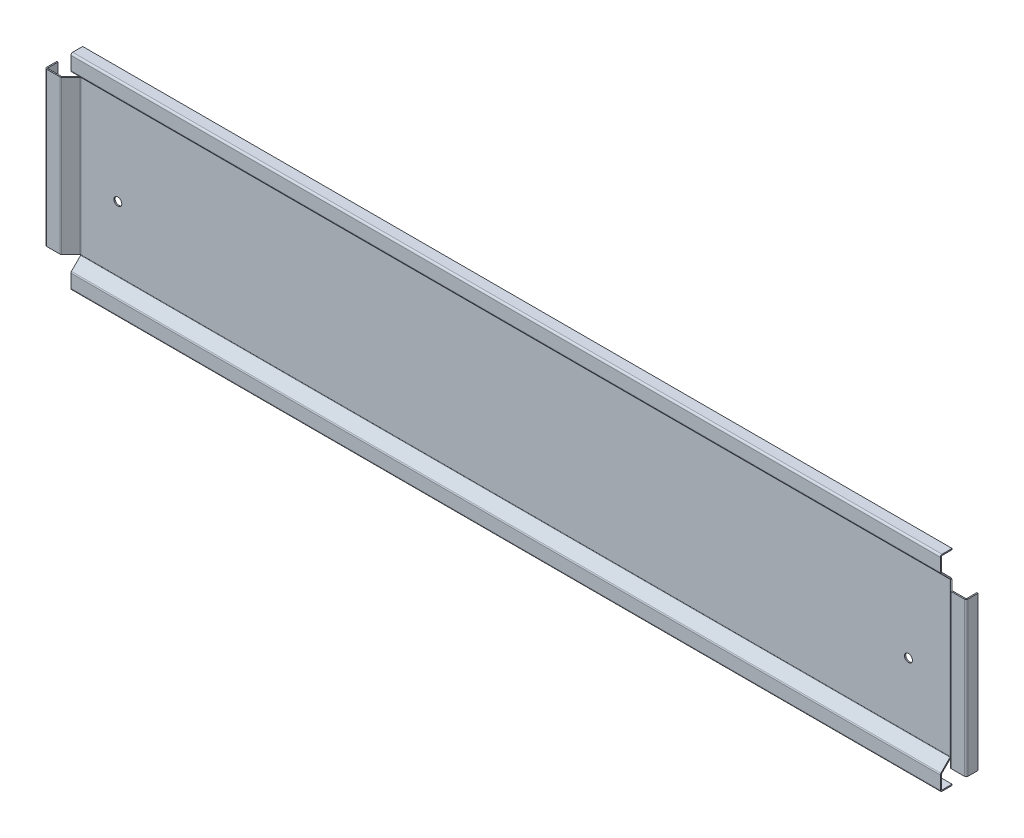
from build123d import *

# Parameters (mm, degrees)
SKETCH1_W                      = 555
SKETCH1_H                      = 100
BASE_FLANGE1_DEPTH             = 1.5
EDGE_FLANGE1_START             = 206.627403552
EDGE_FLANGE1_DEPTH             = 2.426430053
EDGE_FLANGE1_START_2           = -345.946166395
EDGE_FLANGE1_2_DEPTH           = 552.573569947
EDGE_FLANGE1_START_3           = 37.010443104
EDGE_FLANGE1_3_DEPTH           = 97.573569947
EDGE_FLANGE1_4_DEPTH           = 555.946166395
EDGE_FLANGE1_START_4           = 34
EDGE_FLANGE1_5_DEPTH           = 102
EDGE_FLANGE2_START             = 37.010443104
EDGE_FLANGE2_DEPTH             = 97.573569947
EDGE_FLANGE2_START_2           = -345.946166395
EDGE_FLANGE2_2_DEPTH           = 552.573569947
EDGE_FLANGE2_3_DEPTH           = 97.573569947
EDGE_FLANGE2_4_DEPTH           = 552.573569947
EDGE_FLANGE3_STRIP_W           = 7.4732
EDGE_FLANGE3_STRIP_H           = 1.5
EDGE_FLANGE3_STRIP_CUT_DEPTH   = 552.573569946
EDGE_FLANGE3_STRIP_2_W         = 7.4732
EDGE_FLANGE3_STRIP_2_H         = 1.5
EDGE_FLANGE3_STRIP_CUT_2_DEPTH = 97.573569946
EDGE_FLANGE3_DEPTH             = 552.573569946
EDGE_FLANGE3_BEND_DEPTH        = 97.573569946
SKETCH24_R                     = 5
CUT_EXTRUDE1_DEPTH             = 10
LPATTERN1_COUNT                = 2
LPATTERN1_PITCH                = 1005


with BuildPart() as part:
    # Base-Flange1: sheet metal written as solids
    # Sketch1 → Base-Flange1 (new body)
    with BuildSketch(Plane.XY):
        with Locations((-68.446166395, 84.584013051)):
            Rectangle(SKETCH1_W, SKETCH1_H)
    extrude(amount=-BASE_FLANGE1_DEPTH)

    # Edge-Flange1: read off the stored shape, not the designer's step
    # Edge-Flange1 outline → Edge-Flange1 (cut)
    with BuildSketch(Plane.YZ.offset(EDGE_FLANGE1_START)):
        with BuildLine():
            Line((21.941877427, 12.642135624), (35.428928077, -0.844915027))
            ThreePointArc((35.428928077, -0.844915027), (36.154533339, -1.329748962), (37.010443104, -1.5))
            Line((37.010443104, -1.5), (37.010443104, 0))
            ThreePointArc((37.010443104, 0), (36.728558488, 0.056070336), (36.489588249, 0.215745145))
            Line((36.489588249, 0.215745145), (23.002537599, 13.702795796))
            Line((23.002537599, 13.702795796), (21.941877427, 12.642135624))
        make_face()
    extrude(amount=EDGE_FLANGE1_DEPTH, mode=Mode.SUBTRACT)

    # Edge-Flange1 2 outline → Edge-Flange1 2 (add)
    with BuildSketch(Plane.YZ.offset(EDGE_FLANGE1_START_2)):
        with BuildLine():
            Line((21.941877427, 12.642135624), (35.428928077, -0.844915027))
            ThreePointArc((35.428928077, -0.844915027), (36.154533339, -1.329748962), (37.010443104, -1.5))
            Line((37.010443104, -1.5), (37.010443104, 0))
            ThreePointArc((37.010443104, 0), (36.728558488, 0.056070336), (36.489588249, 0.215745145))
            Line((36.489588249, 0.215745145), (23.002537599, 13.702795796))
            Line((23.002537599, 13.702795796), (21.941877427, 12.642135624))
        make_face()
    extrude(amount=EDGE_FLANGE1_2_DEPTH)

    # Edge-Flange1 3 outline → Edge-Flange1 3 (add)
    with BuildSketch(Plane(origin=(0, 0, 0), x_dir=(1, 0, 0), z_dir=(0, 1, 0)).offset(EDGE_FLANGE1_START_3)):
        with BuildLine():
            Line((221.695969229, -12.642135624), (209.053833605, 0))
            Line((209.053833605, 0), (206.627403552, 0))
            ThreePointArc((206.627403552, 0), (206.909288168, -0.056070336), (207.148258407, -0.215745145))
            Line((207.148258407, -0.215745145), (220.635309057, -13.702795796))
            Line((220.635309057, -13.702795796), (221.695969229, -12.642135624))
        make_face()
    extrude(amount=EDGE_FLANGE1_3_DEPTH)

    # Edge-Flange1 4 outline → Edge-Flange1 4 (cut)
    with BuildSketch(Plane.YZ.offset(EDGE_FLANGE1_START_2)):
        with BuildLine():
            ThreePointArc((37.010443104, -1.5), (36.154533339, -1.329748962), (35.428928077, -0.844915027))
            Line((35.428928077, -0.844915027), (34.58401305, 0))
            Line((34.58401305, 0), (34.584013051, -1.5))
            Line((34.584013051, -1.5), (37.010443104, -1.5))
        make_face()
    extrude(amount=EDGE_FLANGE1_4_DEPTH, mode=Mode.SUBTRACT)

    # Edge-Flange1 5 outline → Edge-Flange1 5 (cut)
    with BuildSketch(Plane(origin=(0, 0, 0), x_dir=(1, 0, 0), z_dir=(0, 1, 0)).offset(EDGE_FLANGE1_START_4)):
        with BuildLine():
            ThreePointArc((206.627403552, 1.5), (207.483313316, 1.329748962), (208.208918578, 0.844915027))
            Line((208.208918578, 0.844915027), (209.053833605, 0))
            Line((209.053833605, 0), (209.053833605, 1.5))
            Line((209.053833605, 1.5), (206.627403552, 1.5))
        make_face()
    extrude(amount=EDGE_FLANGE1_5_DEPTH, mode=Mode.SUBTRACT)

    # Edge-Flange2: read off the stored shape, not the designer's step
    # Edge-Flange2 outline → Edge-Flange2 (add)
    with BuildSketch(Plane(origin=(0, 0, 0), x_dir=(1, 0, 0), z_dir=(0, 1, 0)).offset(EDGE_FLANGE2_START)):
        with BuildLine():
            Line((221.695969229, -12.642135624), (239.574648885, -12.642135624))
            Line((239.574648885, -12.642135624), (239.574648885, -11.142135624))
            Line((239.574648885, -11.142135624), (220.501078939, -11.142135624))
            ThreePointArc((220.501078939, -11.142135624), (220.219194323, -11.086065287), (219.980224084, -10.926390479))
            Line((219.980224084, -10.926390479), (221.695969229, -12.642135624))
        make_face()
    extrude(amount=EDGE_FLANGE2_DEPTH)

    # Edge-Flange2 2 outline → Edge-Flange2 2 (add)
    with BuildSketch(Plane.YZ.offset(EDGE_FLANGE2_START_2)):
        with BuildLine():
            Line((23.657622572, 10.926390479), (21.941877427, 12.642135624))
            Line((21.941877427, 12.642135624), (4.06319777, 12.642135624))
            Line((4.06319777, 12.642135624), (4.06319777, 11.142135624))
            Line((4.06319777, 11.142135624), (23.136767717, 11.142135624))
            ThreePointArc((23.136767717, 11.142135624), (23.418652333, 11.086065287), (23.657622572, 10.926390479))
        make_face()
    extrude(amount=EDGE_FLANGE2_2_DEPTH)

    # Edge-Flange2 3 outline → Edge-Flange2 3 (cut)
    with BuildSketch(Plane(origin=(0, 0, 0), x_dir=(1, 0, 0), z_dir=(0, 1, 0)).offset(EDGE_FLANGE2_START)):
        with BuildLine():
            Line((220.635309057, -13.702795796), (221.695969229, -12.642135624))
            Line((221.695969229, -12.642135624), (220.501078939, -12.642135624))
            ThreePointArc((220.501078939, -12.642135624), (219.645169174, -12.471884586), (218.919563912, -11.987050651))
            Line((218.919563912, -11.987050651), (220.635309057, -13.702795796))
        make_face()
    extrude(amount=EDGE_FLANGE2_3_DEPTH, mode=Mode.SUBTRACT)

    # Edge-Flange2 4 outline → Edge-Flange2 4 (cut)
    with BuildSketch(Plane.YZ.offset(EDGE_FLANGE2_START_2)):
        with BuildLine():
            Line((21.941877427, 12.642135624), (23.136767717, 12.642135624))
            ThreePointArc((23.136767717, 12.642135624), (23.992677482, 12.471884586), (24.718282744, 11.987050651))
            Line((24.718282744, 11.987050651), (23.002537599, 13.702795796))
            Line((23.002537599, 13.702795796), (21.941877427, 12.642135624))
        make_face()
    extrude(amount=EDGE_FLANGE2_4_DEPTH, mode=Mode.SUBTRACT)

    # Edge-Flange3: sheet metal written as solids
    # Edge-Flange3 strip (on a plane across the edge) → Edge-Flange3 strip cut (cut)
    with BuildSketch(Plane(origin=(206.627403552, 4.06319777, 11.142135624), x_dir=(0, 1, 0), z_dir=(-1, 0, 0))):
        with Locations((-1.5, -0.75)):
            Rectangle(EDGE_FLANGE3_STRIP_W, EDGE_FLANGE3_STRIP_H)
    extrude(amount=EDGE_FLANGE3_STRIP_CUT_DEPTH, mode=Mode.SUBTRACT)

    # Edge-Flange3 strip 2 (on a plane across the edge) → Edge-Flange3 strip cut 2 (cut)
    with BuildSketch(Plane(origin=(239.574648885, 134.584013051, 11.142135624), x_dir=(-1, 0, 0), z_dir=(0, -1, 0))):
        with Locations((-1.5, -0.75)):
            Rectangle(EDGE_FLANGE3_STRIP_2_W, EDGE_FLANGE3_STRIP_2_H)
    extrude(amount=EDGE_FLANGE3_STRIP_CUT_2_DEPTH, mode=Mode.SUBTRACT)

    # Edge-Flange3 section (on a plane across the edge) → Edge-Flange3 (add)
    with BuildSketch(Plane(origin=(206.627403552, 4.06319777, 11.142135624), x_dir=(0, 1, 0), z_dir=(-1, 0, 0))):
        with BuildLine():
            Line((0, 0.7366), (0, 13.5))
            Line((0, 13.5), (1.5, 13.5))
            Line((1.5, 13.5), (1.5, 0.7366))
            ThreePointArc((1.5, 0.7366), (1.715745145, 0.215745145), (2.2366, 0))
            Line((2.2366, 0), (2.2366, -1.5))
            ThreePointArc((2.2366, -1.5), (0.655084973, -0.844915027), (0, 0.7366))
        make_face()
    extrude(amount=EDGE_FLANGE3_DEPTH)

    # Edge-Flange3 section 2 (on a plane across the edge) → Edge-Flange3 bend (add)
    with BuildSketch(Plane(origin=(239.574648885, 134.584013051, 11.142135624), x_dir=(-1, 0, 0), z_dir=(0, -1, 0))):
        with BuildLine():
            Line((0, 0.7366), (0, 13.5))
            Line((0, 13.5), (1.5, 13.5))
            Line((1.5, 13.5), (1.5, 0.7366))
            ThreePointArc((1.5, 0.7366), (1.715745145, 0.215745145), (2.2366, 0))
            Line((2.2366, 0), (2.2366, -1.5))
            ThreePointArc((2.2366, -1.5), (0.655084973, -0.844915027), (0, 0.7366))
        make_face()
    extrude(amount=EDGE_FLANGE3_BEND_DEPTH)

    # Mirror1: part across plane


with BuildPart() as part_1:
    add(part.part)
    add(part.part.mirror(Plane(origin=(-345.946166395, 134.584013051, -1.5), x_dir=(0, 0, 1), z_dir=(-1, 0, 0))))

    # Mirror2: part across plane


with BuildPart() as part_2:
    add(part_1.part)
    add(part_1.part.mirror(Plane(origin=(-345.946166395, 134.584013051, -1.5), x_dir=(0, 0, 1), z_dir=(0, 1, 0))))

    # Sketch24 → Cut-Extrude1 (cut)
    with BuildSketch(Plane.XY):
        with Locations((-851.466981675, 119.06319777)):
            Circle(SKETCH24_R)
    cut_extrude1 = extrude(amount=-CUT_EXTRUDE1_DEPTH, mode=Mode.SUBTRACT)

    # LPattern1: Cut-Extrude1 ×2
    with Locations(*[(i * LPATTERN1_PITCH, 0, 0) for i in range(1, LPATTERN1_COUNT)]):
        add(cut_extrude1, mode=Mode.SUBTRACT)


solid = part_2.part
